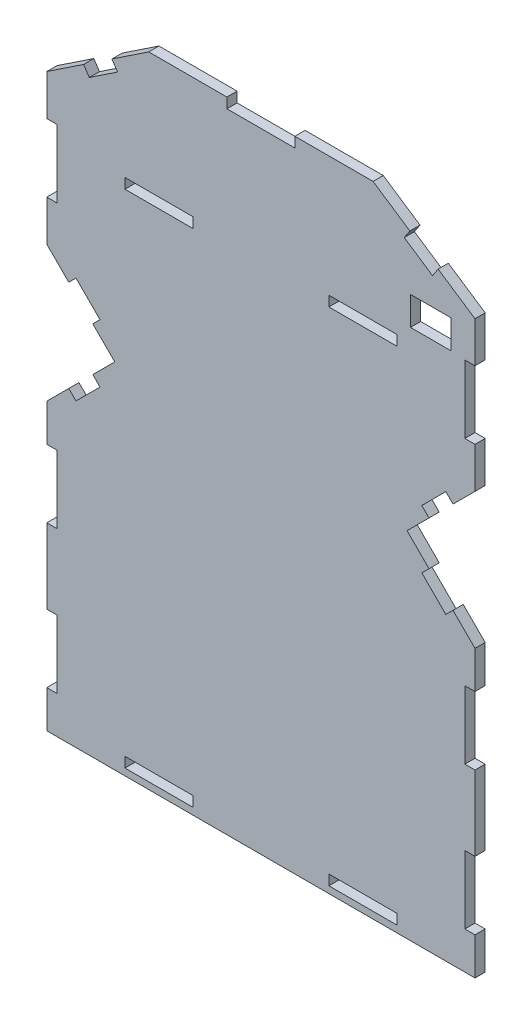
from build123d import *

# Parameters (mm, degrees)
SKETCH1_W           = 20
SKETCH1_H           = 3
SKETCH1_W_2         = 12
SKETCH1_H_2         = 8.4
BOSS_EXTRUDE1_DEPTH = 3


with BuildPart() as part:
    # Sketch1 → Boss-Extrude1 (new body)
    with BuildSketch(Plane.XY):
        Polygon((62.274694919, 0), (62.274694919, -11), (59.274694919, -11), (59.274694919, -31), (62.274694919, -31), (62.274694919, -53), (59.274694919, -53), (59.274694919, -73), (62.274694919, -73), (62.274694919, -84), (-63.725305081, -84), (-63.725305081, -73), (-60.725305081, -73), (-60.725305081, -53), (-63.725305081, -53), (-63.725305081, -31), (-60.725305081, -31), (-60.725305081, -11), (-63.725305081, -11), (-63.725305081, 0), (-57.260838987, 6.464466094), (-55.139518643, 4.343145751), (-48.068450831, 11.414213562), (-50.189771175, 13.535533906), (-43.725305081, 20), (-50.189771175, 26.464466094), (-48.068450831, 28.585786438), (-55.139518643, 35.656854249), (-57.260838987, 33.535533906), (-63.725305081, 40), (-63.725305081, 52), (-60.725305081, 52), (-60.725305081, 72), (-63.725305081, 72), (-63.725305081, 84), (-52.885556553, 91.226499019), (-51.221455964, 88.730348136), (-42.90095302, 94.277350098), (-44.565053609, 96.773500981), (-33.725305081, 104), (-10.725305081, 104), (-10.725305081, 101), (9.274694919, 101), (9.274694919, 104), (32.274694919, 104), (43.114443447, 96.773500981), (41.450342859, 94.277350098), (49.770845802, 88.730348136), (51.434946391, 91.226499019), (62.274694919, 84), (62.274694919, 72), (59.274694919, 72), (59.274694919, 52), (62.274694919, 52), (62.274694919, 40), (55.810228825, 33.535533906), (53.688908482, 35.656854249), (46.61784067, 28.585786438), (48.739161013, 26.464466094), (42.274694919, 20), (48.739161013, 13.535533906), (46.61784067, 11.414213562), (53.688908482, 4.343145751), (55.810228825, 6.464466094), align=None)
        with Locations((29.274694919, -80.5)):
            Rectangle(SKETCH1_W, SKETCH1_H, mode=Mode.SUBTRACT)
        with Locations((-30.725305081, -80.5)):
            Rectangle(SKETCH1_W, SKETCH1_H, mode=Mode.SUBTRACT)
        with Locations((29.274694919, 67)):
            Rectangle(SKETCH1_W, SKETCH1_H, mode=Mode.SUBTRACT)
        with Locations((-30.725305081, 67)):
            Rectangle(SKETCH1_W, SKETCH1_H, mode=Mode.SUBTRACT)
        with Locations((49.274694919, 76.5)):
            Rectangle(SKETCH1_W_2, SKETCH1_H_2, mode=Mode.SUBTRACT)
    extrude(amount=BOSS_EXTRUDE1_DEPTH)


solid = part.part
